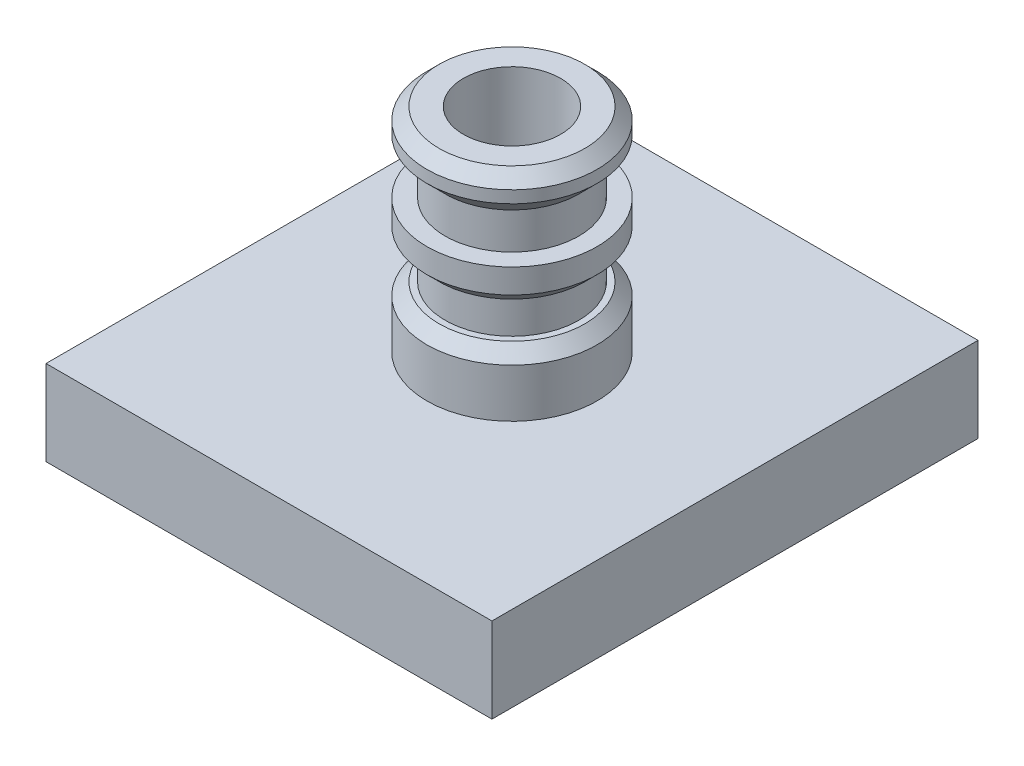
from build123d import *

# Parameters (mm, degrees)
CROQUIS1_W              = 36.7
CROQUIS1_H              = 40
CROQUIS1_R              = 4
SALIENTE_EXTRUIR1_DEPTH = 7
CHAFL_N1_SIZE           = 1
CROQUIS3_R              = 6.55
CORTAR_EXTRUIR1_DEPTH   = 2
CHAFL_N2_SIZE           = 1


with BuildPart() as part:
    # Croquis1 → Saliente-Extruir1 (new body)
    with BuildSketch(Plane(origin=(0, 0, 0), x_dir=(1, 0, 0), z_dir=(0, 1, 0))):
        Rectangle(CROQUIS1_W, CROQUIS1_H)
        Circle(CROQUIS1_R, mode=Mode.SUBTRACT)
    extrude(amount=SALIENTE_EXTRUIR1_DEPTH)

    # Croquis2 → Revolución1 (revolve)
    with BuildSketch(Plane(origin=(0, 0, 0), x_dir=(0, 0, -1), z_dir=(1, 0, 0))):
        Polygon((7, 7), (7, 12), (5.5, 12), (5.5, 15), (7, 15), (7, 18), (5.5, 18), (5.5, 21), (7, 22.5), (7, 24.5), (4, 24.5), (4, 7), align=None)
    revolve(axis=Axis((0, 7, 0), (0, 1, 0)))

    # Chaflán1
    chafl_n1_edges = [part.edges().sort_by_distance(p)[0] for p in [
        (0, 12, 7),
        (0, 15, 7),
    ]]
    chamfer(chafl_n1_edges, length=CHAFL_N1_SIZE)

    # Croquis3 → Cortar-Extruir1 (cut)
    with BuildSketch(Plane.XZ):
        Circle(CROQUIS3_R)
    extrude(amount=-CORTAR_EXTRUIR1_DEPTH, mode=Mode.SUBTRACT)

    # Chaflán2
    chafl_n2_edges = [part.edges().sort_by_distance(p)[0] for p in [
        (0, 24.5, 7),
    ]]
    chamfer(chafl_n2_edges, length=CHAFL_N2_SIZE)


solid = part.part
